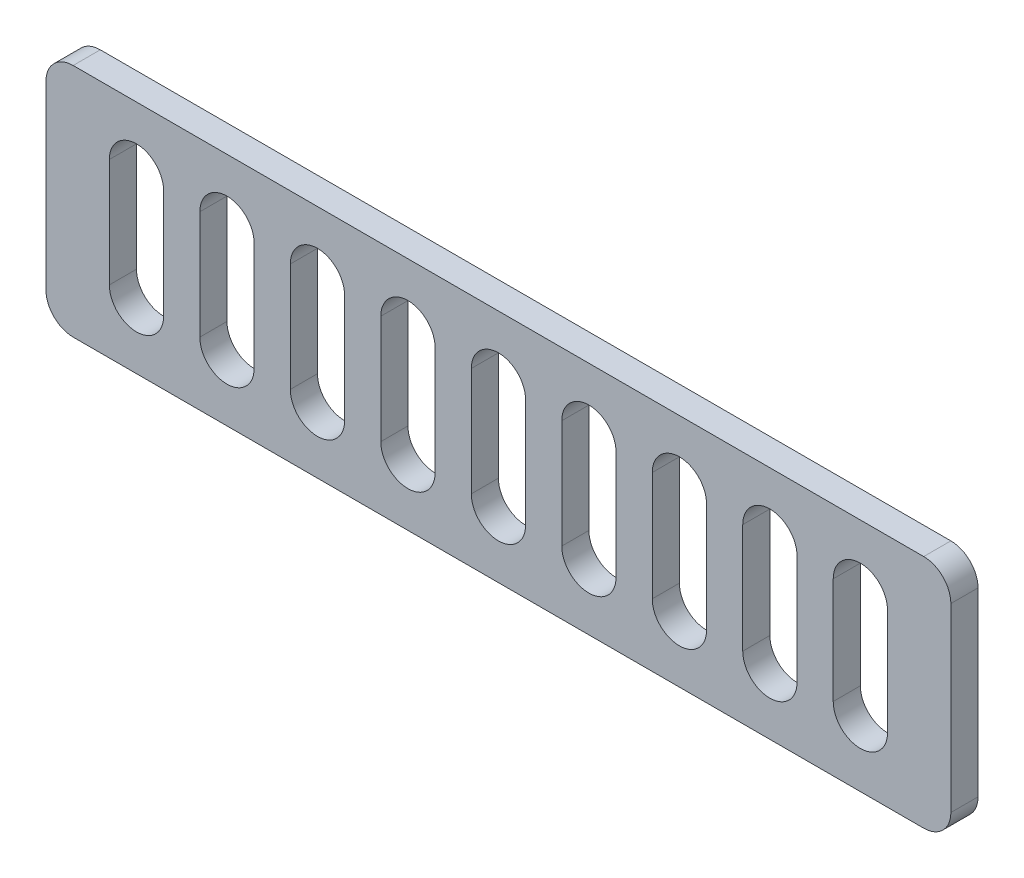
from build123d import *

# Parameters (mm, degrees)
SKETCH1_W           = 100
SKETCH1_H           = 26
BOSS_EXTRUDE1_DEPTH = 3
FILLET1_R           = 3


with BuildPart() as part:
    # Sketch1 → Boss-Extrude1 (new body)
    with BuildSketch(Plane.XY):
        with Locations((-69.498894811, -94.401018189)):
            Rectangle(SKETCH1_W, SKETCH1_H)
        with BuildLine():
            Line((-66.498894811, -88.401018189), (-66.498894811, -100.401018189))
            ThreePointArc((-66.498894811, -100.401018189), (-69.498894811, -103.401018189), (-72.498894811, -100.401018189))
            Line((-72.498894811, -100.401018189), (-72.498894811, -88.401018189))
            ThreePointArc((-72.498894811, -88.401018189), (-69.498894811, -85.401018189), (-66.498894811, -88.401018189))
        make_face(mode=Mode.SUBTRACT)
        with BuildLine():
            Line((-106.498894811, -88.401018189), (-106.498894811, -100.401018189))
            ThreePointArc((-106.498894811, -100.401018189), (-109.498894811, -103.401018189), (-112.498894811, -100.401018189))
            Line((-112.498894811, -100.401018189), (-112.498894811, -88.401018189))
            ThreePointArc((-112.498894811, -88.401018189), (-109.498894811, -85.401018189), (-106.498894811, -88.401018189))
        make_face(mode=Mode.SUBTRACT)
        with BuildLine():
            Line((-96.498894811, -88.401018189), (-96.498894811, -100.401018189))
            ThreePointArc((-96.498894811, -100.401018189), (-99.498894811, -103.401018189), (-102.498894811, -100.401018189))
            Line((-102.498894811, -100.401018189), (-102.498894811, -88.401018189))
            ThreePointArc((-102.498894811, -88.401018189), (-99.498894811, -85.401018189), (-96.498894811, -88.401018189))
        make_face(mode=Mode.SUBTRACT)
        with BuildLine():
            Line((-86.498894811, -88.401018189), (-86.498894811, -100.401018189))
            ThreePointArc((-86.498894811, -100.401018189), (-89.498894811, -103.401018189), (-92.498894811, -100.401018189))
            Line((-92.498894811, -100.401018189), (-92.498894811, -88.401018189))
            ThreePointArc((-92.498894811, -88.401018189), (-89.498894811, -85.401018189), (-86.498894811, -88.401018189))
        make_face(mode=Mode.SUBTRACT)
        with BuildLine():
            Line((-76.498894811, -88.401018189), (-76.498894811, -100.401018189))
            ThreePointArc((-76.498894811, -100.401018189), (-79.498894811, -103.401018189), (-82.498894811, -100.401018189))
            Line((-82.498894811, -100.401018189), (-82.498894811, -88.401018189))
            ThreePointArc((-82.498894811, -88.401018189), (-79.498894811, -85.401018189), (-76.498894811, -88.401018189))
        make_face(mode=Mode.SUBTRACT)
        with BuildLine():
            Line((-56.498894811, -88.401018189), (-56.498894811, -100.401018189))
            ThreePointArc((-56.498894811, -100.401018189), (-59.498894811, -103.401018189), (-62.498894811, -100.401018189))
            Line((-62.498894811, -100.401018189), (-62.498894811, -88.401018189))
            ThreePointArc((-62.498894811, -88.401018189), (-59.498894811, -85.401018189), (-56.498894811, -88.401018189))
        make_face(mode=Mode.SUBTRACT)
        with BuildLine():
            Line((-46.498894811, -88.355569142), (-46.498894811, -100.446467236))
            ThreePointArc((-46.498894811, -100.446467236), (-49.498894811, -103.446467236), (-52.498894811, -100.446467236))
            Line((-52.498894811, -100.446467236), (-52.498894811, -88.355569142))
            ThreePointArc((-52.498894811, -88.355569142), (-49.498894811, -85.355569142), (-46.498894811, -88.355569142))
        make_face(mode=Mode.SUBTRACT)
        with BuildLine():
            Line((-36.498894811, -88.346498653), (-36.498894811, -100.455537725))
            ThreePointArc((-36.498894811, -100.455537725), (-39.498894811, -103.455537725), (-42.498894811, -100.455537725))
            Line((-42.498894811, -100.455537725), (-42.498894811, -88.346498653))
            ThreePointArc((-42.498894811, -88.346498653), (-39.498894811, -85.346498653), (-36.498894811, -88.346498653))
        make_face(mode=Mode.SUBTRACT)
        with BuildLine():
            Line((-26.498894811, -88.531064652), (-26.498894811, -100.270971726))
            ThreePointArc((-26.498894811, -100.270971726), (-29.498894811, -103.270971726), (-32.498894811, -100.270971726))
            Line((-32.498894811, -100.270971726), (-32.498894811, -88.531064652))
            ThreePointArc((-32.498894811, -88.531064652), (-29.498894811, -85.531064652), (-26.498894811, -88.531064652))
        make_face(mode=Mode.SUBTRACT)
    extrude(amount=-BOSS_EXTRUDE1_DEPTH)

    # Fillet1
    fillet1_edges = [part.edges().sort_by_distance(p)[0] for p in [
        (-119.498894811, -107.401018189, -1.5),
        (-19.498894811, -107.401018189, -1.5),
        (-19.498894811, -81.401018189, -1.5),
        (-119.498894811, -81.401018189, -1.5),
    ]]
    fillet(fillet1_edges, radius=FILLET1_R)


solid = part.part
